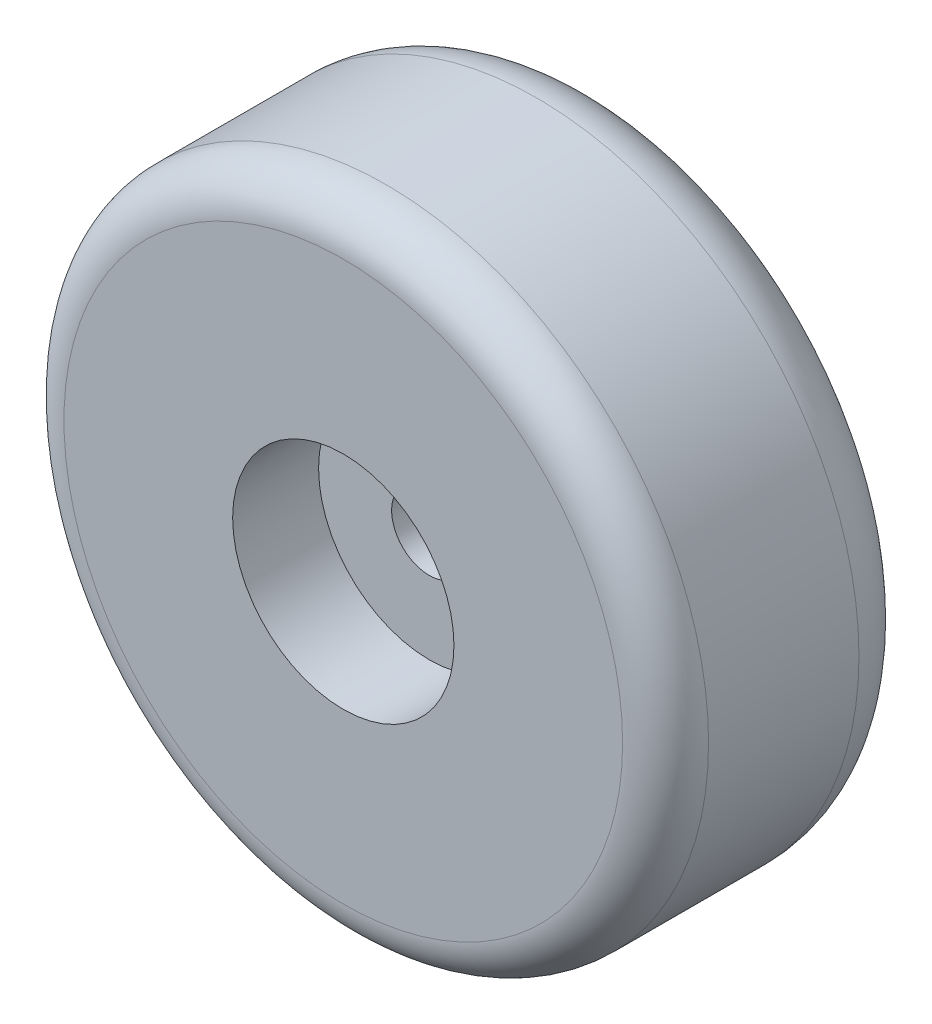
from build123d import *

# Parameters (mm, degrees)
SKETCH_1_R          = 15
SKETCH_1_R_2        = 1.75
EXTRUDE_1_DEPTH     = 12
SKETCH_2_R          = 5.15
CUT_EXTRUDE_1_DEPTH = 4
FILLET_1_R          = 2
FILLET_2_R          = 3


with BuildPart() as part:
    # Эскиз1 → Бобышка-Вытянуть1 (new body)
    with BuildSketch(Plane.XY):
        Circle(SKETCH_1_R)
        Circle(SKETCH_1_R_2, mode=Mode.SUBTRACT)
    extrude(amount=EXTRUDE_1_DEPTH)

    # Эскиз2 → Вырез-Вытянуть1 (cut)
    with BuildSketch(Plane.XY.offset(12)):
        Circle(SKETCH_2_R)
    extrude(amount=-CUT_EXTRUDE_1_DEPTH, mode=Mode.SUBTRACT)

    # Скругление1
    fillet_1_edges = [part.edges().sort_by_distance(p)[0] for p in [
        (-15, 0, 12),
    ]]
    fillet(fillet_1_edges, radius=FILLET_1_R)

    # Скругление2
    fillet_2_edges = [part.edges().sort_by_distance(p)[0] for p in [
        (-15, 0, 0),
    ]]
    fillet(fillet_2_edges, radius=FILLET_2_R)


solid = part.part
